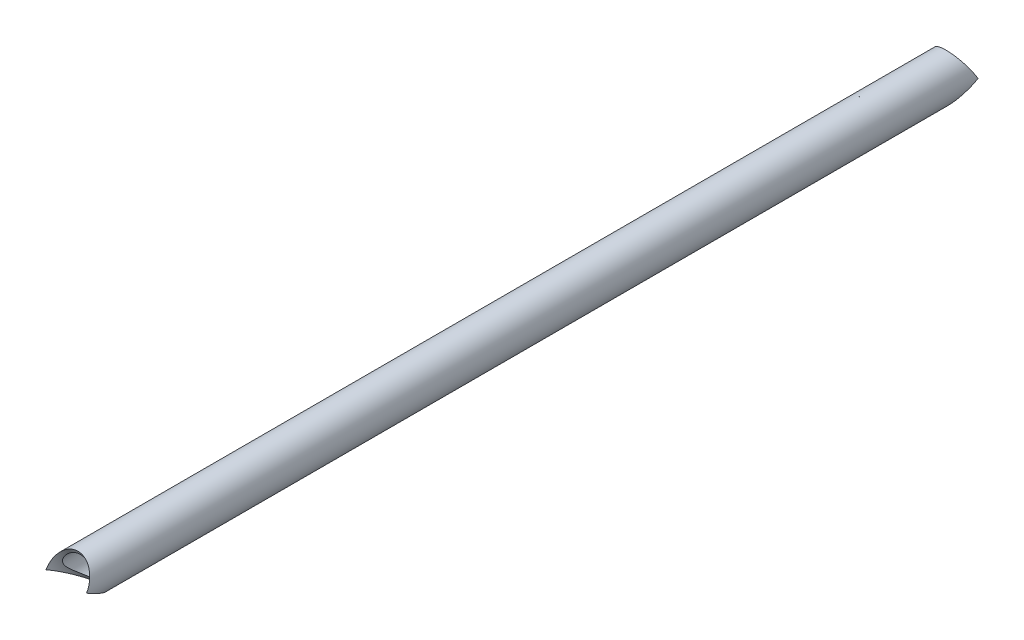
from build123d import *

# Parameters (mm, degrees)
EXTRUDE_START         = -233.790157948
EXTRUDE_1_OUTLINE_R   = 10.65
EXTRUDE_1_OUTLINE_R_2 = 8.65
EXTRUDE_1_DEPTH       = 233.790157948
EXTRUDE_START_2       = 111
EXTRUDE_1_2_DEPTH     = 29


with BuildPart() as part:
    # Бобышка-Вытянуть1: read off the stored shape, not the designer's step
    # Бобышка-Вытянуть1 outline → Бобышка-Вытянуть1 (new body)
    with BuildSketch(Plane.XY.offset(EXTRUDE_START)):
        with Locations((0, 15.225)):
            Circle(EXTRUDE_1_OUTLINE_R)
        with Locations((0, 15.225)):
            Circle(EXTRUDE_1_OUTLINE_R_2, mode=Mode.SUBTRACT)
    extrude(amount=EXTRUDE_1_DEPTH)

    # Extrude 1 2 outline → Extrude 1 2 (cut)
    with BuildSketch(Plane(origin=(0, 0, 0), x_dir=(1, 0, 0), z_dir=(0, 0.8660254037845095, -0.4999999999998773)).offset(EXTRUDE_START_2)):
        with BuildLine():
            ThreePointArc((-10.65, 194.855715851), (0, 184.205715851), (10.65, 194.855715851))
            Line((10.65, 194.855715851), (10.65, 202))
            Line((10.65, 202), (-10.65, 202))
            Line((-10.65, 202), (-10.65, 194.855715851))
        make_face()
    extrude(amount=EXTRUDE_1_2_DEPTH, mode=Mode.SUBTRACT)

    # Зеркальное отражение1: part across plane


with BuildPart() as part_1:
    add(part.part)
    add(part.part.mirror(Plane(origin=(0, 15.225, 0), x_dir=(1, 0, 0), z_dir=(0, 0, 1))))


solid = part_1.part
